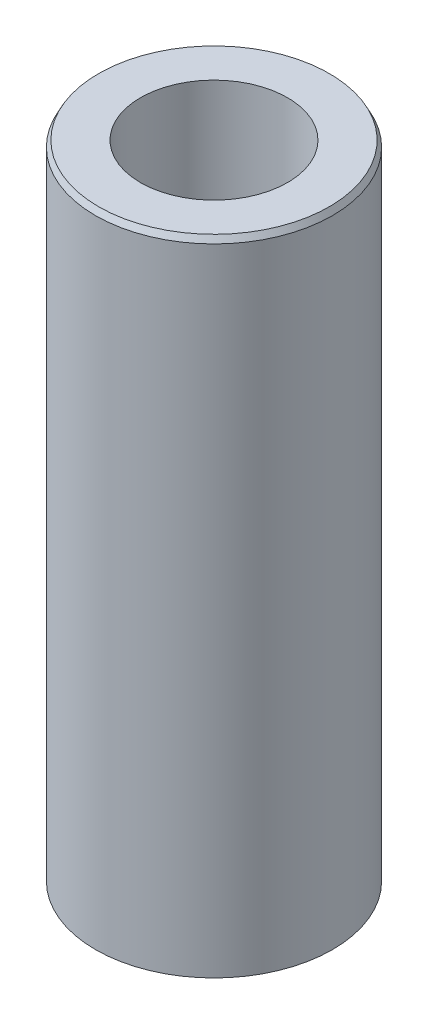
from build123d import *
from OCP.BRepFilletAPI import BRepFilletAPI_MakeChamfer

# Parameters (mm, degrees)
SKETCH1_R           = 52.5
BOSS_EXTRUDE1_DEPTH = 285.669680138
SKETCH2_R           = 32.580222072
CUT_EXTRUDE1_DEPTH  = 296.16040749
CHAMFER1_SIZE       = 2.705226887
CHAMFER1_SIZE2      = 1.402293569


with BuildPart() as part:
    # Sketch1 → Boss-Extrude1 (new body)
    with BuildSketch(Plane(origin=(0, 0, 0), x_dir=(1, 0, 0), z_dir=(0, 1, 0))):
        Circle(SKETCH1_R)
    extrude(amount=BOSS_EXTRUDE1_DEPTH)

    # Sketch2 → Cut-Extrude1 (cut, through all)
    with BuildSketch(Plane(origin=(0, 0, 0), x_dir=(1, 0, 0), z_dir=(0, 1, 0))):
        Circle(SKETCH2_R)
    extrude(amount=CUT_EXTRUDE1_DEPTH, mode=Mode.SUBTRACT)

    # Chamfer1: one chamfer whose edges measure the first distance from different faces: ONE call of the kernel's chamfer builder (chamfer() names one face for all edges)
    chamfer1_edges_1 = [part.edges().sort_by_distance(p)[0] for p in [
        (-52.5, 285.669680138, 0),
    ]]
    chamfer1_side_1 = [part.faces().sort_by_distance(p)[0] for p in [
        (-52.5, 142.834840069, 0),
    ]]
    chamfer1_edges_2 = [part.edges().sort_by_distance(p)[0] for p in [
        (-52.5, 0, 0),
    ]]
    chamfer1_side_2 = [part.faces().sort_by_distance(p)[0] for p in [
        (-51.01507576, 0, 0),
    ]]
    chamfer1 = BRepFilletAPI_MakeChamfer(part.part.solid().wrapped)
    for e in chamfer1_edges_1:
        chamfer1.Add(CHAMFER1_SIZE, CHAMFER1_SIZE2, e.wrapped, chamfer1_side_1[0].wrapped)  # the first distance lies on this face
    for e in chamfer1_edges_2:
        chamfer1.Add(CHAMFER1_SIZE, CHAMFER1_SIZE2, e.wrapped, chamfer1_side_2[0].wrapped)  # the first distance lies on this face
    add(Compound.cast(chamfer1.Shape()), mode=Mode.REPLACE)


solid = part.part
